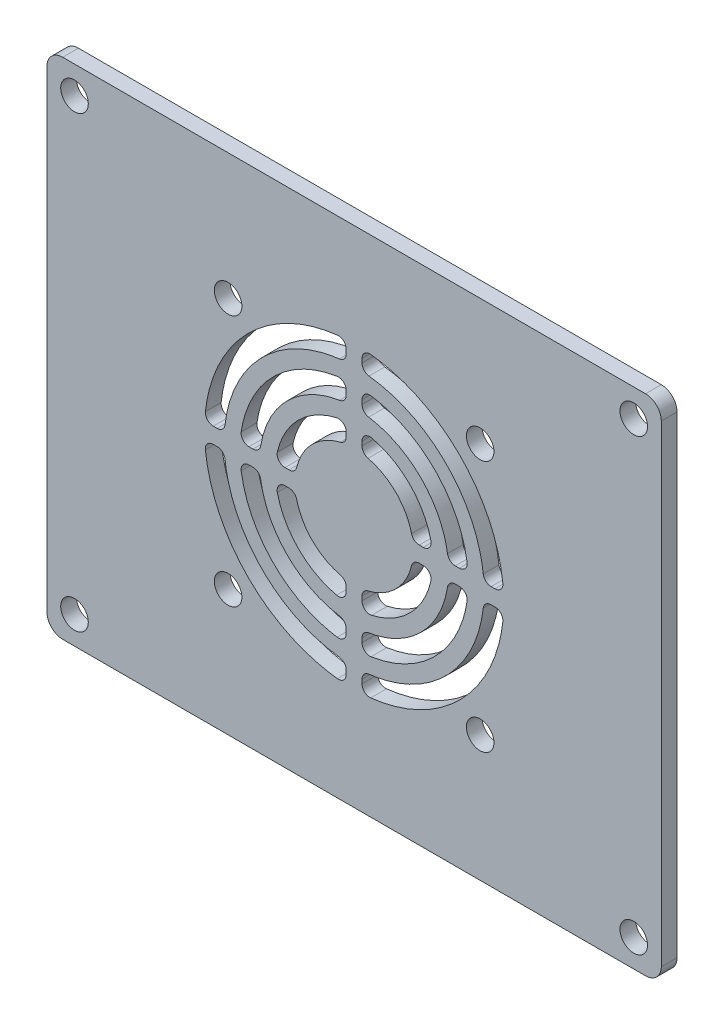
from build123d import *

# Parameters (mm, degrees)
SKETCH1_R           = 1.75
BOSS_EXTRUDE1_DEPTH = 1
VENT1_START         = -1
VENT1_DEPTH         = 2
SKETCH3_R           = 1.75
CUT_EXTRUDE1_DEPTH  = 51.48762239


# Read off the part's stored shape, not the designer's step: Vent1
with BuildPart() as part:
    # Sketch1 → Boss-Extrude1 (new, symmetric)
    with BuildSketch(Plane.XY):
        with BuildLine():
            Line((-37, 32), (37, 32))
            ThreePointArc((37, 32), (38.414213562, 31.414213562), (39, 30))
            Line((39, 30), (39, -30))
            ThreePointArc((39, -30), (38.414213562, -31.414213562), (37, -32))
            Line((37, -32), (-37, -32))
            ThreePointArc((-37, -32), (-38.414213562, -31.414213562), (-39, -30))
            Line((-39, -30), (-39, 30))
            ThreePointArc((-39, 30), (-38.414213562, 31.414213562), (-37, 32))
        make_face()
        with Locations((-35.5, 28.5)):
            Circle(SKETCH1_R, mode=Mode.SUBTRACT)
        with Locations((35.5, 28.5)):
            Circle(SKETCH1_R, mode=Mode.SUBTRACT)
        with Locations((35.5, -28.5)):
            Circle(SKETCH1_R, mode=Mode.SUBTRACT)
        with Locations((-35.5, -28.5)):
            Circle(SKETCH1_R, mode=Mode.SUBTRACT)
    extrude(amount=BOSS_EXTRUDE1_DEPTH, both=True)

    # Vent1 outline → Vent1 (cut)
    with BuildSketch(Plane.XY.offset(VENT1_START)):
        with BuildLine():
            ThreePointArc((-17.888471771, -1), (-18.633820522, -1.333325238), (-18.882282174, -2.111089523))
            add(Edge.make_bspline(
                [(-18.882282174, -2.111089523), (-18.822472233, -2.64615116), (-18.549360333, -4.408660603), (-17.666865742, -7.317855395), (-15.899759105, -10.623879382), (-13.521633642, -13.521633642), (-10.623879382, -15.899759105), (-7.317855395, -17.666865742), (-4.408660603, -18.549360333), (-2.64615116, -18.822472233), (-2.111089523, -18.882282174)],
                knots=[0.517720343, 0.517720343, 0.517720343, 0.517720343, 0.53125, 0.5625, 0.59375, 0.625, 0.65625, 0.6875, 0.71875, 0.732279657, 0.732279657, 0.732279657, 0.732279657], degree=3))
            ThreePointArc((-2.111089523, -18.882282174), (-1.333325238, -18.633820522), (-1, -17.888471771))
            Line((-1, -17.888471771), (-1, -17.385277303))
            ThreePointArc((-1, -17.385277303), (-1.253587953, -16.719793226), (-1.885738113, -16.391826639))
            add(Edge.make_bspline(
                [(-16.391826642, -1.885738091), (-16.340412651, -2.332757258), (-16.10352529, -3.845484158), (-15.342278144, -6.354979685), (-13.807685538, -9.226000516), (-11.742471321, -11.742471321), (-9.226000516, -13.807685538), (-6.354979685, -15.342278144), (-3.845484158, -16.10352529), (-2.332757258, -16.340412651), (-1.885738113, -16.391826639)],
                knots=[0.518229247, 0.518229247, 0.518229247, 0.518229247, 0.53125, 0.5625, 0.59375, 0.625, 0.65625, 0.6875, 0.71875, 0.731770753, 0.731770753, 0.731770753, 0.731770753], degree=3))
            ThreePointArc((-16.391826642, -1.885738091), (-16.719793224, -1.253587955), (-17.385277303, -1))
            Line((-17.385277303, -1), (-17.888471771, -1))
        make_face()
        with BuildLine():
            ThreePointArc((1, -17.888471771), (1.333325238, -18.633820522), (2.111089523, -18.882282174))
            add(Edge.make_bspline(
                [(2.111089523, -18.882282174), (2.64615116, -18.822472233), (4.408660603, -18.549360333), (7.317855395, -17.666865742), (10.623879382, -15.899759105), (13.521633642, -13.521633642), (15.899759105, -10.623879382), (17.666865742, -7.317855395), (18.549360333, -4.408660603), (18.822472233, -2.64615116), (18.882282174, -2.111089523)],
                knots=[0.767720343, 0.767720343, 0.767720343, 0.767720343, 0.78125, 0.8125, 0.84375, 0.875, 0.90625, 0.9375, 0.96875, 0.982279657, 0.982279657, 0.982279657, 0.982279657], degree=3))
            ThreePointArc((18.882282174, -2.111089523), (18.633820522, -1.333325238), (17.888471771, -1))
            Line((17.888471771, -1), (17.385277303, -1))
            ThreePointArc((17.385277303, -1), (16.719793225, -1.253587954), (16.391826639, -1.885738116))
            add(Edge.make_bspline(
                [(1.885738091, -16.391826642), (2.332757258, -16.340412651), (3.845484158, -16.10352529), (6.354979685, -15.342278144), (9.226000516, -13.807685538), (11.742471321, -11.742471321), (13.807685538, -9.226000516), (15.342278144, -6.354979685), (16.10352529, -3.845484158), (16.340412651, -2.332757258), (16.391826639, -1.885738116)],
                knots=[0.768229247, 0.768229247, 0.768229247, 0.768229247, 0.78125, 0.8125, 0.84375, 0.875, 0.90625, 0.9375, 0.96875, 0.981770753, 0.981770753, 0.981770753, 0.981770753], degree=3))
            ThreePointArc((1.885738091, -16.391826642), (1.253587955, -16.719793224), (1, -17.385277303))
            Line((1, -17.385277303), (1, -17.888471771))
        make_face()
        with BuildLine():
            ThreePointArc((-1, 17.888471771), (-1.333325238, 18.633820522), (-2.111089523, 18.882282174))
            add(Edge.make_bspline(
                [(-2.111089523, 18.882282174), (-2.64615116, 18.822472233), (-4.408660603, 18.549360333), (-7.317855395, 17.666865742), (-10.623879382, 15.899759105), (-13.521633642, 13.521633642), (-15.899759105, 10.623879382), (-17.666865742, 7.317855395), (-18.549360333, 4.408660603), (-18.822472233, 2.64615116), (-18.882282174, 2.111089523)],
                knots=[0.267720343, 0.267720343, 0.267720343, 0.267720343, 0.28125, 0.3125, 0.34375, 0.375, 0.40625, 0.4375, 0.46875, 0.482279657, 0.482279657, 0.482279657, 0.482279657], degree=3))
            ThreePointArc((-18.882282174, 2.111089523), (-18.633820522, 1.333325238), (-17.888471771, 1))
            Line((-17.888471771, 1), (-17.385277303, 1))
            ThreePointArc((-17.385277303, 1), (-16.719793226, 1.253587953), (-16.391826639, 1.885738113))
            add(Edge.make_bspline(
                [(-1.885738091, 16.391826642), (-2.332757258, 16.340412651), (-3.845484158, 16.10352529), (-6.354979685, 15.342278144), (-9.226000516, 13.807685538), (-11.742471321, 11.742471321), (-13.807685538, 9.226000516), (-15.342278144, 6.354979685), (-16.10352529, 3.845484158), (-16.340412651, 2.332757258), (-16.391826639, 1.885738113)],
                knots=[0.268229247, 0.268229247, 0.268229247, 0.268229247, 0.28125, 0.3125, 0.34375, 0.375, 0.40625, 0.4375, 0.46875, 0.481770753, 0.481770753, 0.481770753, 0.481770753], degree=3))
            ThreePointArc((-1.885738091, 16.391826642), (-1.253587955, 16.719793224), (-1, 17.385277303))
            Line((-1, 17.385277303), (-1, 17.888471771))
        make_face()
        with BuildLine():
            ThreePointArc((17.888471771, 1), (18.633820522, 1.333325238), (18.882282174, 2.111089523))
            add(Edge.make_bspline(
                [(18.882282174, 2.111089523), (18.822472233, 2.64615116), (18.549360333, 4.408660603), (17.666865742, 7.317855395), (15.899759105, 10.623879382), (13.521633642, 13.521633642), (10.623879382, 15.899759105), (7.317855395, 17.666865742), (4.408660603, 18.549360333), (2.64615116, 18.822472233), (2.111089523, 18.882282174)],
                knots=[0.017720343, 0.017720343, 0.017720343, 0.017720343, 0.03125, 0.0625, 0.09375, 0.125, 0.15625, 0.1875, 0.21875, 0.232279657, 0.232279657, 0.232279657, 0.232279657], degree=3))
            ThreePointArc((2.111089523, 18.882282174), (1.333325238, 18.633820522), (1, 17.888471771))
            Line((1, 17.888471771), (1, 17.385277303))
            ThreePointArc((1, 17.385277303), (1.253587953, 16.719793226), (1.885738113, 16.391826639))
            add(Edge.make_bspline(
                [(16.391826642, 1.885738091), (16.340412651, 2.332757258), (16.10352529, 3.845484158), (15.342278144, 6.354979685), (13.807685538, 9.226000516), (11.742471321, 11.742471321), (9.226000516, 13.807685538), (6.354979685, 15.342278144), (3.845484158, 16.10352529), (2.332757258, 16.340412651), (1.885738113, 16.391826639)],
                knots=[0.018229247, 0.018229247, 0.018229247, 0.018229247, 0.03125, 0.0625, 0.09375, 0.125, 0.15625, 0.1875, 0.21875, 0.231770753, 0.231770753, 0.231770753, 0.231770753], degree=3))
            ThreePointArc((16.391826642, 1.885738091), (16.719793225, 1.253587954), (17.385277303, 1))
            Line((17.385277303, 1), (17.888471771, 1))
        make_face()
        with BuildLine():
            ThreePointArc((-1, 8.77495496), (-1.376414586, 9.556710185), (-2.222282464, 9.74993727))
            add(Edge.make_bspline(
                [(-2.222282464, 9.74993727), (-2.770217549, 9.62501566), (-3.933474986, 9.254535365), (-5.591515464, 8.368294266), (-7.116649285, 7.116649285), (-8.368294266, 5.591515464), (-9.254535364, 3.933474987), (-9.625015659, 2.770217553), (-9.749937272, 2.222282458)],
                knots=[0.285666571, 0.285666571, 0.285666571, 0.285666571, 0.3125, 0.34375, 0.375, 0.40625, 0.4375, 0.464333429, 0.464333429, 0.464333429, 0.464333429], degree=3))
            ThreePointArc((-9.749937272, 2.222282458), (-9.556710185, 1.376414586), (-8.77495496, 1))
            Line((-8.77495496, 1), (-8.261342586, 1))
            ThreePointArc((-8.261342586, 1), (-7.643017036, 1.214077921), (-7.289431182, 1.764652971))
            add(Edge.make_bspline(
                [(-1.764652956, 7.289431186), (-2.141715774, 7.198125936), (-2.97982629, 6.925015826), (-4.193636598, 6.276220699), (-5.337486964, 5.337486964), (-6.276220699, 4.193636598), (-6.925015825, 2.979826291), (-7.198125935, 2.141715777), (-7.289431182, 1.764652971)],
                knots=[0.287801616, 0.287801616, 0.287801616, 0.287801616, 0.3125, 0.34375, 0.375, 0.40625, 0.4375, 0.462198384, 0.462198384, 0.462198384, 0.462198384], degree=3))
            ThreePointArc((-1.764652956, 7.289431186), (-1.214077921, 7.643017036), (-1, 8.261342586))
            Line((-1, 8.261342586), (-1, 8.77495496))
        make_face()
        with BuildLine():
            add(Edge.make_bspline(
                [(-1.846209494, 11.857107737), (-2.01175668, 11.831341624), (-2.950283425, 11.665070511), (-4.621803407, 11.158020468), (-6.709818557, 10.041953119), (-8.539979142, 8.539979142), (-10.041953119, 6.709818557), (-11.158020468, 4.621803407), (-11.665070511, 2.950283425), (-11.831341624, 2.01175668), (-11.857107737, 1.846209494)],
                knots=[0.274583762, 0.274583762, 0.274583762, 0.274583762, 0.28125, 0.3125, 0.34375, 0.375, 0.40625, 0.4375, 0.46875, 0.475416238, 0.475416238, 0.475416238, 0.475416238], degree=3))
            ThreePointArc((-1.846209494, 11.857107737), (-1.240463797, 12.194746183), (-1, 12.845211213))
            Line((-1, 12.845211213), (-1, 13.350998977))
            ThreePointArc((-1, 13.350998977), (-1.347345613, 14.108654736), (-2.148084501, 14.339973688))
            add(Edge.make_bspline(
                [(-2.148084501, 14.339973688), (-2.375893337, 14.305862653), (-3.538094561, 14.103432704), (-5.584679117, 13.482608066), (-8.107697423, 12.134026685), (-10.319141464, 10.319141464), (-12.134026685, 8.107697423), (-13.482608066, 5.584679117), (-14.103432704, 3.538094561), (-14.305862653, 2.375893337), (-14.339973692, 2.148084474)],
                knots=[0.273664929, 0.273664929, 0.273664929, 0.273664929, 0.28125, 0.3125, 0.34375, 0.375, 0.40625, 0.4375, 0.46875, 0.476335071, 0.476335071, 0.476335071, 0.476335071], degree=3))
            ThreePointArc((-14.339973692, 2.148084474), (-14.108654738, 1.347345614), (-13.350998977, 1))
            Line((-13.350998977, 1), (-12.845211213, 1))
            ThreePointArc((-12.845211213, 1), (-12.194746181, 1.240463798), (-11.857107737, 1.846209494))
        make_face()
        with BuildLine():
            ThreePointArc((-8.77495496, -1), (-9.556710185, -1.376414586), (-9.74993727, -2.222282464))
            add(Edge.make_bspline(
                [(-9.74993727, -2.222282464), (-9.62501566, -2.770217549), (-9.254535365, -3.933474986), (-8.368294266, -5.591515464), (-7.116649285, -7.116649285), (-5.591515464, -8.368294266), (-3.933474987, -9.254535364), (-2.770217553, -9.625015659), (-2.222282458, -9.749937272)],
                knots=[0.535666571, 0.535666571, 0.535666571, 0.535666571, 0.5625, 0.59375, 0.625, 0.65625, 0.6875, 0.714333429, 0.714333429, 0.714333429, 0.714333429], degree=3))
            ThreePointArc((-2.222282458, -9.749937272), (-1.376414586, -9.556710185), (-1, -8.77495496))
            Line((-1, -8.77495496), (-1, -8.261342586))
            ThreePointArc((-1, -8.261342586), (-1.214077921, -7.643017036), (-1.764652971, -7.289431182))
            add(Edge.make_bspline(
                [(-7.289431186, -1.764652956), (-7.198125936, -2.141715774), (-6.925015826, -2.97982629), (-6.276220699, -4.193636598), (-5.337486964, -5.337486964), (-4.193636598, -6.276220699), (-2.979826291, -6.925015825), (-2.141715777, -7.198125935), (-1.764652971, -7.289431182)],
                knots=[0.537801616, 0.537801616, 0.537801616, 0.537801616, 0.5625, 0.59375, 0.625, 0.65625, 0.6875, 0.712198384, 0.712198384, 0.712198384, 0.712198384], degree=3))
            ThreePointArc((-7.289431186, -1.764652956), (-7.643017036, -1.214077921), (-8.261342586, -1))
            Line((-8.261342586, -1), (-8.77495496, -1))
        make_face()
        with BuildLine():
            add(Edge.make_bspline(
                [(-11.857107737, -1.846209494), (-11.831341624, -2.01175668), (-11.665070511, -2.950283425), (-11.158020468, -4.621803407), (-10.041953119, -6.709818557), (-8.539979142, -8.539979142), (-6.709818557, -10.041953119), (-4.621803407, -11.158020468), (-2.950283425, -11.665070511), (-2.01175668, -11.831341624), (-1.846209494, -11.857107737)],
                knots=[0.524583762, 0.524583762, 0.524583762, 0.524583762, 0.53125, 0.5625, 0.59375, 0.625, 0.65625, 0.6875, 0.71875, 0.725416238, 0.725416238, 0.725416238, 0.725416238], degree=3))
            ThreePointArc((-11.857107737, -1.846209494), (-12.194746183, -1.240463797), (-12.845211213, -1))
            Line((-12.845211213, -1), (-13.350998977, -1))
            ThreePointArc((-13.350998977, -1), (-14.108654736, -1.347345613), (-14.339973688, -2.148084501))
            add(Edge.make_bspline(
                [(-14.339973688, -2.148084501), (-14.305862653, -2.375893337), (-14.103432704, -3.538094561), (-13.482608066, -5.584679117), (-12.134026685, -8.107697423), (-10.319141464, -10.319141464), (-8.107697423, -12.134026685), (-5.584679117, -13.482608066), (-3.538094561, -14.103432704), (-2.375893337, -14.305862653), (-2.148084474, -14.339973692)],
                knots=[0.523664929, 0.523664929, 0.523664929, 0.523664929, 0.53125, 0.5625, 0.59375, 0.625, 0.65625, 0.6875, 0.71875, 0.726335071, 0.726335071, 0.726335071, 0.726335071], degree=3))
            ThreePointArc((-2.148084474, -14.339973692), (-1.347345614, -14.108654738), (-1, -13.350998977))
            Line((-1, -13.350998977), (-1, -12.845211213))
            ThreePointArc((-1, -12.845211213), (-1.240463798, -12.194746181), (-1.846209494, -11.857107737))
        make_face()
        with BuildLine():
            ThreePointArc((1, -8.77495496), (1.376414586, -9.556710185), (2.222282464, -9.74993727))
            add(Edge.make_bspline(
                [(2.222282464, -9.74993727), (2.770217549, -9.62501566), (3.933474986, -9.254535365), (5.591515464, -8.368294266), (7.116649285, -7.116649285), (8.368294266, -5.591515464), (9.254535364, -3.933474987), (9.625015659, -2.770217553), (9.749937272, -2.222282458)],
                knots=[0.785666571, 0.785666571, 0.785666571, 0.785666571, 0.8125, 0.84375, 0.875, 0.90625, 0.9375, 0.964333429, 0.964333429, 0.964333429, 0.964333429], degree=3))
            ThreePointArc((9.749937272, -2.222282458), (9.556710185, -1.376414586), (8.77495496, -1))
            Line((8.77495496, -1), (8.261342586, -1))
            ThreePointArc((8.261342586, -1), (7.643017036, -1.214077921), (7.289431182, -1.764652971))
            add(Edge.make_bspline(
                [(1.764652956, -7.289431186), (2.141715774, -7.198125936), (2.97982629, -6.925015826), (4.193636598, -6.276220699), (5.337486964, -5.337486964), (6.276220699, -4.193636598), (6.925015825, -2.979826291), (7.198125935, -2.141715777), (7.289431182, -1.764652971)],
                knots=[0.787801616, 0.787801616, 0.787801616, 0.787801616, 0.8125, 0.84375, 0.875, 0.90625, 0.9375, 0.962198384, 0.962198384, 0.962198384, 0.962198384], degree=3))
            ThreePointArc((1.764652956, -7.289431186), (1.214077921, -7.643017036), (1, -8.261342586))
            Line((1, -8.261342586), (1, -8.77495496))
        make_face()
        with BuildLine():
            add(Edge.make_bspline(
                [(1.846209494, -11.857107737), (2.01175668, -11.831341624), (2.950283425, -11.665070511), (4.621803407, -11.158020468), (6.709818557, -10.041953119), (8.539979142, -8.539979142), (10.041953119, -6.709818557), (11.158020468, -4.621803407), (11.665070511, -2.950283425), (11.831341624, -2.01175668), (11.857107737, -1.846209494)],
                knots=[0.774583762, 0.774583762, 0.774583762, 0.774583762, 0.78125, 0.8125, 0.84375, 0.875, 0.90625, 0.9375, 0.96875, 0.975416238, 0.975416238, 0.975416238, 0.975416238], degree=3))
            ThreePointArc((1.846209494, -11.857107737), (1.240463797, -12.194746183), (1, -12.845211213))
            Line((1, -12.845211213), (1, -13.350998977))
            ThreePointArc((1, -13.350998977), (1.347345613, -14.108654736), (2.148084501, -14.339973688))
            add(Edge.make_bspline(
                [(2.148084501, -14.339973688), (2.375893337, -14.305862653), (3.538094561, -14.103432704), (5.584679117, -13.482608066), (8.107697423, -12.134026685), (10.319141464, -10.319141464), (12.134026685, -8.107697423), (13.482608066, -5.584679117), (14.103432704, -3.538094561), (14.305862653, -2.375893337), (14.339973692, -2.148084474)],
                knots=[0.773664929, 0.773664929, 0.773664929, 0.773664929, 0.78125, 0.8125, 0.84375, 0.875, 0.90625, 0.9375, 0.96875, 0.976335071, 0.976335071, 0.976335071, 0.976335071], degree=3))
            ThreePointArc((14.339973692, -2.148084474), (14.108654739, -1.347345615), (13.350998977, -1))
            Line((13.350998977, -1), (12.845211213, -1))
            ThreePointArc((12.845211213, -1), (12.19474618, -1.240463799), (11.857107737, -1.846209494))
        make_face()
        with BuildLine():
            add(Edge.make_bspline(
                [(11.857107737, 1.846209494), (11.831341624, 2.01175668), (11.665070511, 2.950283425), (11.158020468, 4.621803407), (10.041953119, 6.709818557), (8.539979142, 8.539979142), (6.709818557, 10.041953119), (4.621803407, 11.158020468), (2.950283425, 11.665070511), (2.01175668, 11.831341624), (1.846209494, 11.857107737)],
                knots=[0.024583762, 0.024583762, 0.024583762, 0.024583762, 0.03125, 0.0625, 0.09375, 0.125, 0.15625, 0.1875, 0.21875, 0.225416238, 0.225416238, 0.225416238, 0.225416238], degree=3))
            ThreePointArc((11.857107737, 1.846209494), (12.194746183, 1.240463796), (12.845211213, 1))
            Line((12.845211213, 1), (13.350998977, 1))
            ThreePointArc((13.350998977, 1), (14.108654736, 1.347345612), (14.339973689, 2.148084499))
            add(Edge.make_bspline(
                [(14.339973689, 2.148084499), (14.305862653, 2.375893337), (14.103432704, 3.538094561), (13.482608066, 5.584679117), (12.134026685, 8.107697423), (10.319141464, 10.319141464), (8.107697423, 12.134026685), (5.584679117, 13.482608066), (3.538094561, 14.103432704), (2.375893337, 14.305862653), (2.148084474, 14.339973692)],
                knots=[0.023664929, 0.023664929, 0.023664929, 0.023664929, 0.03125, 0.0625, 0.09375, 0.125, 0.15625, 0.1875, 0.21875, 0.226335071, 0.226335071, 0.226335071, 0.226335071], degree=3))
            ThreePointArc((2.148084474, 14.339973692), (1.347345614, 14.108654738), (1, 13.350998977))
            Line((1, 13.350998977), (1, 12.845211213))
            ThreePointArc((1, 12.845211213), (1.240463798, 12.194746181), (1.846209494, 11.857107737))
        make_face()
        with BuildLine():
            ThreePointArc((8.77495496, 1), (9.556710185, 1.376414586), (9.74993727, 2.222282464))
            add(Edge.make_bspline(
                [(9.74993727, 2.222282464), (9.62501566, 2.770217549), (9.254535365, 3.933474986), (8.368294266, 5.591515464), (7.116649285, 7.116649285), (5.591515464, 8.368294266), (3.933474987, 9.254535364), (2.770217553, 9.625015659), (2.222282458, 9.749937272)],
                knots=[0.035666571, 0.035666571, 0.035666571, 0.035666571, 0.0625, 0.09375, 0.125, 0.15625, 0.1875, 0.214333429, 0.214333429, 0.214333429, 0.214333429], degree=3))
            ThreePointArc((2.222282458, 9.749937272), (1.376414586, 9.556710185), (1, 8.77495496))
            Line((1, 8.77495496), (1, 8.261342586))
            ThreePointArc((1, 8.261342586), (1.214077921, 7.643017036), (1.764652971, 7.289431182))
            add(Edge.make_bspline(
                [(7.289431186, 1.764652956), (7.198125936, 2.141715774), (6.925015826, 2.97982629), (6.276220699, 4.193636598), (5.337486964, 5.337486964), (4.193636598, 6.276220699), (2.979826291, 6.925015825), (2.141715777, 7.198125935), (1.764652971, 7.289431182)],
                knots=[0.037801616, 0.037801616, 0.037801616, 0.037801616, 0.0625, 0.09375, 0.125, 0.15625, 0.1875, 0.212198384, 0.212198384, 0.212198384, 0.212198384], degree=3))
            ThreePointArc((7.289431186, 1.764652956), (7.643017036, 1.214077921), (8.261342586, 1))
            Line((8.261342586, 1), (8.77495496, 1))
        make_face()
    extrude(amount=VENT1_DEPTH, mode=Mode.SUBTRACT)

    # Sketch3 → Cut-Extrude1 (cut, through all)
    with BuildSketch(Plane.XY.offset(1)):
        with Locations((-16, 16)):
            Circle(SKETCH3_R)
        with Locations((16, 16)):
            Circle(SKETCH3_R)
        with Locations((16, -16)):
            Circle(SKETCH3_R)
        with Locations((-16, -16)):
            Circle(SKETCH3_R)
    extrude(amount=-CUT_EXTRUDE1_DEPTH, mode=Mode.SUBTRACT)


solid = part.part
